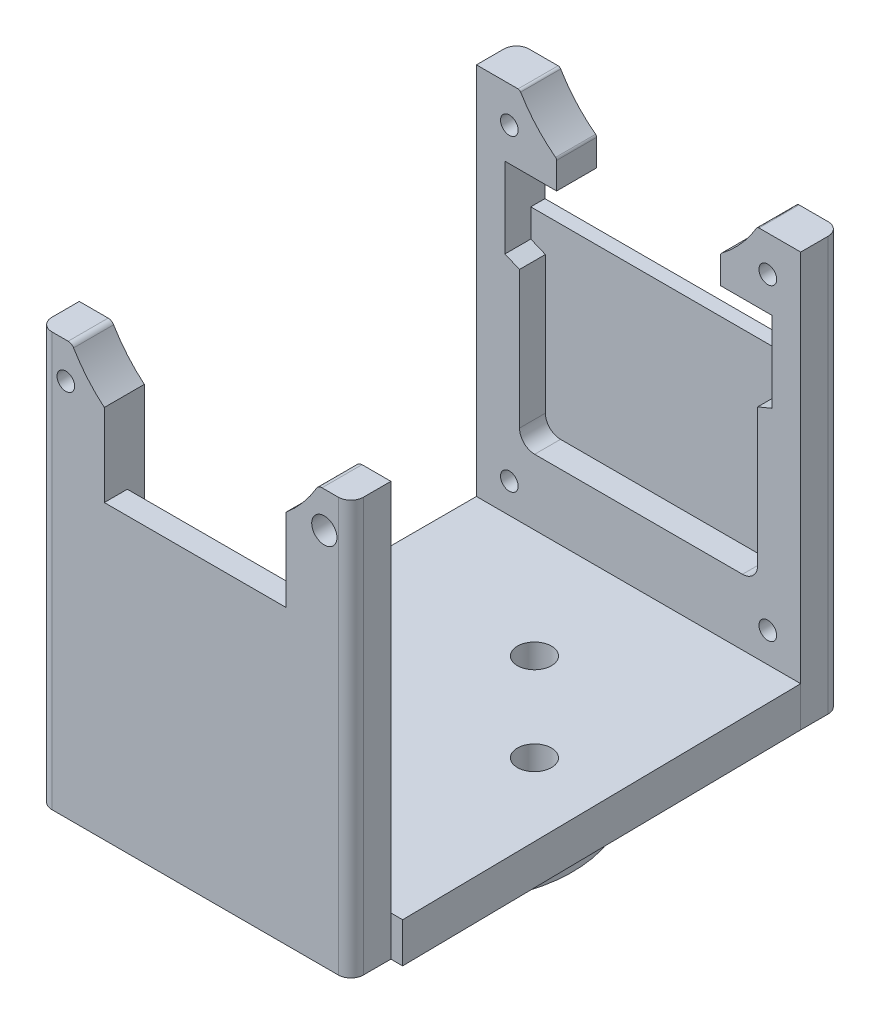
from build123d import *
from OCP.BRepAlgoAPI import BRepAlgoAPI_Cut
from OCP.TopTools import TopTools_ListOfShape

# Parameters (mm, degrees)
SKETCH1_R                 = 10
SKETCH1_R_2               = 1.35
BOSS_EXTRUDE1_DEPTH       = 3.175
SKETCH2_W                 = 38.058543228
SKETCH2_H                 = 41.75
SKETCH2_R                 = 1.35
BOSS_EXTRUDE2_DEPTH       = 3.175
SKETCH3_W                 = 38.058543228
SKETCH3_H                 = 41.75
SKETCH3_W_2               = 31.708543228
SKETCH3_H_2               = 35.4
BOSS_EXTRUDE3_DEPTH       = 20
FILLET1_R                 = 5
BOSS_EXTRUDE4_OUTLINE_R   = 1
BOSS_EXTRUDE4_OUTLINE_R_2 = 0.698520241
BOSS_EXTRUDE4_OUTLINE_R_3 = 0.699131638
BOSS_EXTRUDE4_DEPTH       = 4.524579022
SKETCH6_R                 = 0.699665004
SKETCH6_R_2               = 0.703272365
SKETCH6_R_3               = 0.700673295
SKETCH6_R_4               = 0.698053945
BOSS_EXTRUDE5_DEPTH       = 5.225420978
CUT_EXTRUDE3_DEPTH        = 39.629021569
CUT_EXTRUDE4_DEPTH        = 44.672508997
FILLET2_R                 = 1


with BuildPart() as part:
    # Sketch1 → Boss-Extrude1 (new body)
    with BuildSketch(Plane(origin=(0, 0, 0), x_dir=(1, 0, 0), z_dir=(0, 1, 0))):
        with Locations(Location((0, 0, 0), (0, 0, 270))):
            Circle(SKETCH1_R)
        with Locations(Location((0, 7, 0), (0, 0, 270))):
            Circle(SKETCH1_R_2, mode=Mode.SUBTRACT)
        with Locations(Location((7, 0, 0), (0, 0, 270))):
            Circle(SKETCH1_R_2, mode=Mode.SUBTRACT)
        with Locations(Location((0, -7, 0), (0, 0, 270))):
            Circle(SKETCH1_R_2, mode=Mode.SUBTRACT)
        with Locations(Location((-7, 0, 0), (0, 0, 270))):
            Circle(SKETCH1_R_2, mode=Mode.SUBTRACT)
    extrude(amount=BOSS_EXTRUDE1_DEPTH)

    # Sketch2 → Boss-Extrude2 (add)
    with BuildSketch(Plane(origin=(0, 3.175, 0), x_dir=(1, 0, 0), z_dir=(0, 1, 0))):
        Rectangle(SKETCH2_W, SKETCH2_H)
        with Locations(Location((0, -7, 0), (0, 0, 270))):
            Circle(SKETCH2_R, mode=Mode.SUBTRACT)
        with Locations(Location((7, 0, 0), (0, 0, 270))):
            Circle(SKETCH2_R, mode=Mode.SUBTRACT)
        with Locations(Location((-7, 0, 0), (0, 0, 270))):
            Circle(SKETCH2_R, mode=Mode.SUBTRACT)
        with Locations(Location((0, 7, 0), (0, 0, 270))):
            Circle(SKETCH2_R, mode=Mode.SUBTRACT)
    extrude(amount=BOSS_EXTRUDE2_DEPTH)

    # Sketch3 → Boss-Extrude3 (add)
    with BuildSketch(Plane(origin=(0, 6.35, 0), x_dir=(1, 0, 0), z_dir=(0, 1, 0))):
        Rectangle(SKETCH3_W, SKETCH3_H)
        Rectangle(SKETCH3_W_2, SKETCH3_H_2, mode=Mode.SUBTRACT)
    extrude(amount=BOSS_EXTRUDE3_DEPTH)

    # Fillet1
    fillet1_edges = [part.edges().sort_by_distance(p)[0] for p in [
        (-19.029271614, 14.7625, -20.875),
        (-19.029271614, 14.7625, 20.875),
        (19.029271614, 14.7625, 20.875),
        (19.029271614, 14.7625, -20.875),
    ]]
    fillet(fillet1_edges, radius=FILLET1_R)

    # Boss-Extrude4: read off the stored shape, not the designer's step
    # Boss-Extrude4 outline → Boss-Extrude4 (add)
    # profile 1 of 2: a face of its own
    with BuildSketch(Plane.XY.offset(16.350420978)):
        with BuildLine():
            ThreePointArc((9.674791631, 35.998523082), (9.427181956, 35.932908065), (9.244559074, 35.753284112))
            ThreePointArc((9.244559074, 35.753284112), (8.147643376, 34.213929311), (6.807481387, 32.880961337))
            Line((6.807481387, 32.880961337), (6.807482447, 6.35))
            Line((6.807482447, 6.35), (11.963760646, 6.35))
            Line((11.963760646, 6.35), (11.963760646, 35.998520144))
            Line((11.963760646, 35.998520144), (9.674791631, 35.998523082))
        make_face()
        with Locations((9.857482447, 33.16)):
            Circle(BOSS_EXTRUDE4_OUTLINE_R, mode=Mode.SUBTRACT)
        with Locations((9.857482447, 12.46)):
            Circle(BOSS_EXTRUDE4_OUTLINE_R, mode=Mode.SUBTRACT)
    # profile 2 of 2: a face of its own
    with BuildSketch(Plane.XY.offset(16.350420978)):
        with BuildLine():
            Line((-12.751066043, 35.998520144), (-12.751066043, 6.35))
            Line((-12.751066043, 6.35), (-7.592517553, 6.35))
            Line((-7.592517553, 6.35), (-7.592516964, 32.880958857))
            ThreePointArc((-7.592516964, 32.880958857), (-8.932679762, 34.213927416), (-10.029597495, 35.753282149))
            ThreePointArc((-10.029597495, 35.753282149), (-10.212218516, 35.932905514), (-10.459826737, 35.998520144))
            Line((-10.459826737, 35.998520144), (-12.751066043, 35.998520144))
        make_face()
        with Locations((-10.642517553, 33.16)):
            Circle(BOSS_EXTRUDE4_OUTLINE_R_2, mode=Mode.SUBTRACT)
        with Locations((-10.642517553, 12.46)):
            Circle(BOSS_EXTRUDE4_OUTLINE_R_3, mode=Mode.SUBTRACT)
    extrude(amount=BOSS_EXTRUDE4_DEPTH)

    # Sketch6 → Boss-Extrude5 (add)
    with BuildSketch(Plane(origin=(0, 0, -15.649579022), x_dir=(-1, 0, 0), z_dir=(0, 0, -1))):
        with BuildLine():
            Line((10.992517553, 24.135), (10.992517553, 30.51))
            Line((10.992517553, 30.51), (7.192517366, 30.510000072))
            Line((7.192517366, 30.510000072), (6.892517553, 30.510000072))
            Line((6.892517553, 30.510000072), (6.892517553, 32.612557612))
            add(Edge.make_bspline(
                [(6.975743415, 32.783855976), (6.958921233, 32.771091761), (6.928542383, 32.73934935), (6.899316538, 32.679660552), (6.892517469, 32.634957243), (6.892517553, 32.612557612)],
                knots=[1.062e-06, 1.062e-06, 1.062e-06, 1.062e-06, 0.322323684, 0.658094096, 1, 1, 1, 1], degree=3, weights=[1, 1, 1, 1, 1, 1]))
            ThreePointArc((6.975743415, 32.783855976), (8.509170356, 34.198162413), (9.744817778, 35.878887355))
            add(Edge.make_bspline(
                [(9.950114528, 35.998516481), (9.923391157, 35.998516414), (9.869066225, 35.989019468), (9.796326784, 35.947026629), (9.759487209, 35.903468994), (9.744817778, 35.878887355)],
                knots=[0, 0, 0, 0, 0.324047023, 0.652881456, 1, 1, 1, 1], degree=3, weights=[1, 1, 1, 1, 1, 1]))
            Line((9.950114528, 35.998516481), (11.752517552, 35.998516481))
            Line((11.752517552, 35.998516481), (13.252517552, 35.998516481))
            Line((13.252517552, 35.998516481), (13.252517552, 6.318190736))
            Line((13.252517552, 6.318190736), (-12.46748245, 6.318190736))
            Line((-12.46748245, 6.318190736), (-12.46748245, 35.998516481))
            Line((-12.46748245, 35.998516481), (-10.96748245, 35.998516481))
            Line((-10.96748245, 35.998516481), (-9.165078771, 35.998516481))
            add(Edge.make_bspline(
                [(-8.959782959, 35.878887832), (-8.974454973, 35.903473814), (-9.011299786, 35.947034481), (-9.084041461, 35.989022268), (-9.138360889, 35.998516579), (-9.165078771, 35.998516481)],
                knots=[3.25e-07, 3.25e-07, 3.25e-07, 3.25e-07, 0.347182134, 0.676017862, 1, 1, 1, 1], degree=3, weights=[1, 1, 1, 1, 1, 1]))
            ThreePointArc((-8.959782959, 35.878887832), (-7.72413548, 34.198162669), (-6.190708414, 32.783856055))
            add(Edge.make_bspline(
                [(-6.107482447, 32.612555023), (-6.107481996, 32.634920643), (-6.114271613, 32.679614721), (-6.143476784, 32.739319032), (-6.173880837, 32.77108775), (-6.190708414, 32.783856055)],
                knots=[0, 0, 0, 0, 0.341381322, 0.677579946, 1, 1, 1, 1], degree=3, weights=[1, 1, 1, 1, 1, 1]))
            Line((-6.107482447, 32.612555023), (-6.107482447, 30.510000072))
            Line((-6.107482447, 30.510000072), (-6.407482262, 30.510000072))
            Line((-6.407482262, 30.510000072), (-10.207482447, 30.51))
            Line((-10.207482447, 30.51), (-10.207482447, 24.135))
            Line((-10.207482447, 24.135), (-9.049769141, 23.654765682))
            Line((-9.049769141, 23.654765682), (-9.049769141, 12.756914674))
            ThreePointArc((-9.049769141, 12.756914674), (-8.698297278, 11.908386539), (-7.849769141, 11.556914678))
            Line((-7.849769141, 11.556914678), (8.634804248, 11.556914678))
            ThreePointArc((8.634804248, 11.556914678), (9.483332385, 11.908386541), (9.834804247, 12.756914678))
            Line((9.834804247, 12.756914678), (9.834804247, 23.654765682))
            Line((9.834804247, 23.654765682), (10.992517553, 24.135))
        make_face()
        with Locations(Location((-9.857482447, 8.71, 0), (0, 0, 180))):
            Circle(SKETCH6_R, mode=Mode.SUBTRACT)
        with Locations(Location((-9.857482447, 33.16, 0), (0, 0, 180))):
            Circle(SKETCH6_R_2, mode=Mode.SUBTRACT)
        with Locations(Location((10.642517553, 33.16, 0), (0, 0, 180))):
            Circle(SKETCH6_R_3, mode=Mode.SUBTRACT)
        with Locations(Location((10.642517553, 8.71, 0), (0, 0, 180))):
            Circle(SKETCH6_R_4, mode=Mode.SUBTRACT)
    extrude(amount=BOSS_EXTRUDE5_DEPTH)

    # Sketch7 → Cut-Extrude3 (cut, through all)
    with BuildSketch(Plane(origin=(0, 26.35, 0), x_dir=(1, 0, 0), z_dir=(0, 1, 0))):
        Polygon((11.963760646, -16.350420978), (11.963760646, -22.528007323), (30.022930958, -23.761888284), (27.696884363, 28.84716935), (12.46748245, 20.875), (12.46748245, 15.649579022), (12.894365171, -16.350420978), align=None)
        Polygon((-12.751066043, -16.350420978), (-12.751066043, -23.761888284), (-21.517724294, -22.528007323), (-21.901635858, 22.206155736), (-13.252517552, 20.875), (-13.252517552, -16.350420978), align=None)
    extrude(amount=-CUT_EXTRUDE3_DEPTH, mode=Mode.SUBTRACT)


with BuildPart() as cut_extrude4_tool:
    # Sketch9 → Cut-Extrude4 (new, through all)
    with BuildSketch(Plane(origin=(-2e-09, 35.998516482, 0), x_dir=(1.0, 6.10309035182258e-11, 0), z_dir=(-6.10309035182258e-11, 1.0, -1.0368003232160358e-14))):
        Polygon((-12.751066041, -19.525420978), (13.891993445, -19.525420978), (13.555046053, -22.524424576), (-19.185008861, -22.524424576), align=None)
        Polygon((-13.25251755, 18.824579022), (15.127467216, 18.824579022), (13.105782864, 23.749676422), (-20.139693138, 23.131939537), align=None)
    extrude(amount=-CUT_EXTRUDE4_DEPTH)


with BuildPart() as part_1:
    add(part.part)

    # Cut-Extrude4: cut by cut_extrude4_tool, with a tolerance
    cut_extrude4_stock = TopTools_ListOfShape()
    cut_extrude4_stock.Append(part_1.part.wrapped)
    cut_extrude4_tools = TopTools_ListOfShape()
    cut_extrude4_tools.Append(cut_extrude4_tool.part.wrapped)
    cut_extrude4_cut = BRepAlgoAPI_Cut()
    cut_extrude4_cut.SetArguments(cut_extrude4_stock)
    cut_extrude4_cut.SetTools(cut_extrude4_tools)
    cut_extrude4_cut.SetFuzzyValue(0.00001)
    cut_extrude4_cut.Build()
    add(Compound.cast(cut_extrude4_cut.Shape()).solids(), mode=Mode.REPLACE)

    # Fillet2
    fillet2_edges = [part_1.edges().sort_by_distance(p)[0] for p in [
        (12.46748245, 19.58675824, -18.824579022),
        (-13.252517551, 19.58675824, -18.824579022),
        (-12.751066042, 19.58675824, 19.525420978),
        (11.963760646, 19.586758241, 19.525420978),
    ]]
    fillet(fillet2_edges, radius=FILLET2_R)


solid = part_1.part
